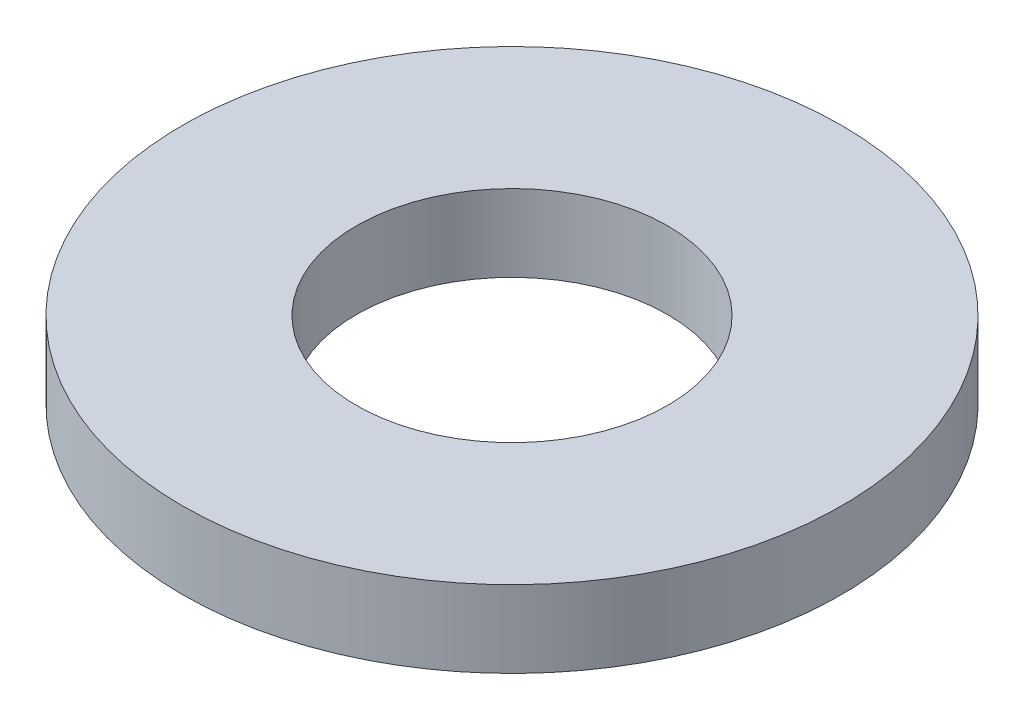
from build123d import *

# Parameters (mm, degrees)
SKETCH1_R           = 90
BOSS_EXTRUDE1_DEPTH = 21
SKETCH2_R           = 42.5
CUT_EXTRUDE1_DEPTH  = 130


with BuildPart() as part:
    # Sketch1 → Boss-Extrude1 (new body)
    with BuildSketch(Plane(origin=(0, 0, 0), x_dir=(1, 0, 0), z_dir=(0, 1, 0))):
        Circle(SKETCH1_R)
    extrude(amount=BOSS_EXTRUDE1_DEPTH)

    # Sketch2 → Cut-Extrude1 (cut, through all)
    with BuildSketch(Plane(origin=(0, 0, 0), x_dir=(1, 0, 0), z_dir=(0, 1, 0))):
        Circle(SKETCH2_R)
    extrude(amount=CUT_EXTRUDE1_DEPTH, mode=Mode.SUBTRACT)


solid = part.part
